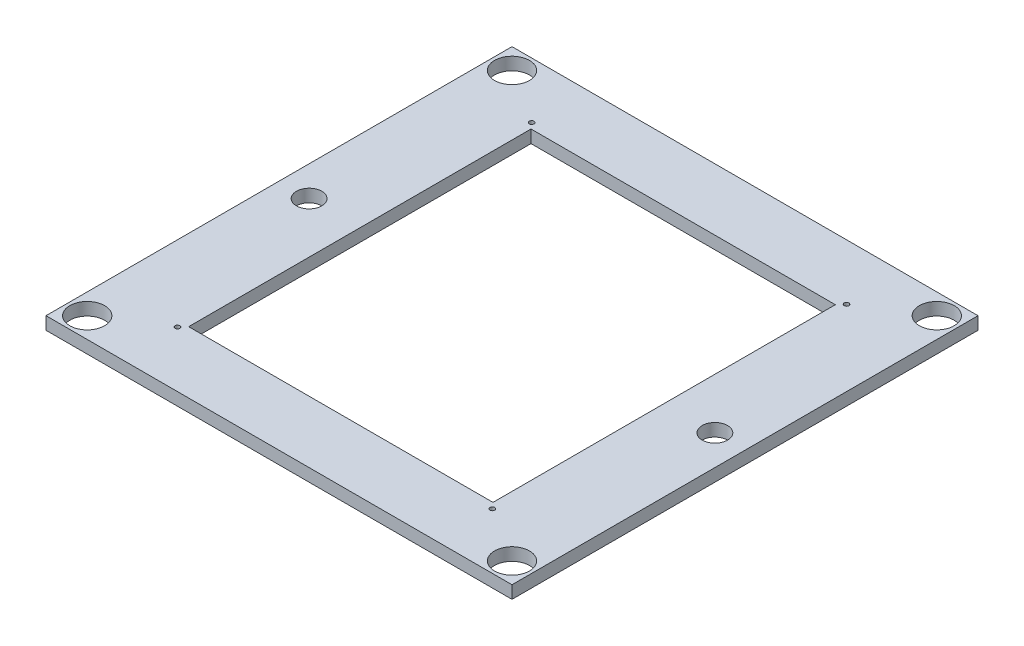
from build123d import *

# Parameters (mm, degrees)
SKETCH1_W               = 294
SKETCH1_H               = 294
SKETCH1_W_2             = 192
SKETCH1_H_2             = 216
BOSS_EXTRUDE1_DEPTH     = 8
SKETCH2_R               = 11
CUT_EXTRUDE1_DEPTH      = 209.043264731
SKETCH4_R               = 8
CUT_EXTRUDE2_DEPTH      = 209.043264731
MIRROR3_COPY_1_SKETCH_R = 11
MIRROR3_COPY_1_DEPTH    = 209.043264731
SKETCH5_R               = 1.5
CUT_EXTRUDE3_DEPTH      = 209.043264731


with BuildPart() as part:
    # Sketch1 → Boss-Extrude1 (new body)
    with BuildSketch(Plane(origin=(0, 0, 0), x_dir=(1, 0, 0), z_dir=(0, 1, 0))):
        Rectangle(SKETCH1_W, SKETCH1_H)
        Rectangle(SKETCH1_W_2, SKETCH1_H_2, mode=Mode.SUBTRACT)
    extrude(amount=BOSS_EXTRUDE1_DEPTH)

    # Sketch2 → Cut-Extrude1 (cut, through all)
    with BuildSketch(Plane(origin=(0, 0, 0), x_dir=(1, 0, 0), z_dir=(0, 1, 0))):
        with Locations((134, 134)):
            Circle(SKETCH2_R)
    cut_extrude1 = extrude(amount=CUT_EXTRUDE1_DEPTH, mode=Mode.SUBTRACT)

    # Mirror2: Cut-Extrude1 across plane
    add(cut_extrude1.mirror(Plane.XY), mode=Mode.SUBTRACT)

    # Sketch4 → Cut-Extrude2 (cut, through all)
    with BuildSketch(Plane(origin=(0, 8, 0), x_dir=(1, 0, 0), z_dir=(0, 1, 0))):
        with Locations((128, 0)):
            Circle(SKETCH4_R)
    cut_extrude2 = extrude(amount=-CUT_EXTRUDE2_DEPTH, mode=Mode.SUBTRACT)

    # Mirror3: Cut-Extrude1 across plane
    add(cut_extrude1.mirror(Plane(origin=(0, 0, 0), x_dir=(0, 0, 1), z_dir=(1, 0, 0))), mode=Mode.SUBTRACT)

    # Mirror3 copy 1 sketch → Mirror3 copy 1 (cut, through all)
    with BuildSketch(Plane(origin=(0, 0, 0), x_dir=(-1, 0, 0), z_dir=(0, 1, 0))):
        with Locations((134, 134)):
            Circle(MIRROR3_COPY_1_SKETCH_R)
    extrude(amount=MIRROR3_COPY_1_DEPTH, mode=Mode.SUBTRACT)

    # Mirror4: Cut-Extrude2 across plane
    add(cut_extrude2.mirror(Plane(origin=(0, 0, 0), x_dir=(0, 0, 1), z_dir=(1, 0, 0))), mode=Mode.SUBTRACT)

    # Sketch5 → Cut-Extrude3 (cut, through all)
    with BuildSketch(Plane(origin=(0, 8, 0), x_dir=(1, 0, 0), z_dir=(0, 1, 0))):
        with Locations((-99.321819194, 111.737046593)):
            Circle(SKETCH5_R)
        with Locations((99.321819194, -111.737046593)):
            Circle(SKETCH5_R)
        with Locations((-99.321819194, -111.737046593)):
            Circle(SKETCH5_R)
        with Locations((99.321819194, 111.737046593)):
            Circle(SKETCH5_R)
    extrude(amount=-CUT_EXTRUDE3_DEPTH, mode=Mode.SUBTRACT)


solid = part.part
